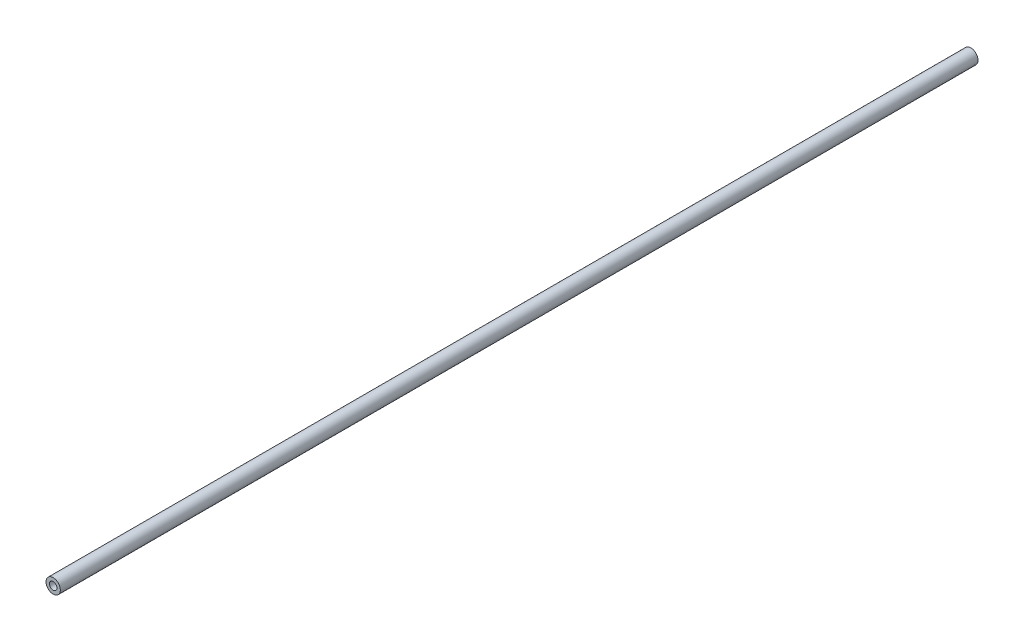
from build123d import *

# Parameters (mm, degrees)
SKETCH1_R           = 4.7625
SKETCH1_R_2         = 2.4892
BOSS_EXTRUDE1_DEPTH = 304.8


with BuildPart() as part:
    # Sketch1 → Boss-Extrude1 (new, symmetric)
    with BuildSketch(Plane.XY):
        Circle(SKETCH1_R)
        Circle(SKETCH1_R_2, mode=Mode.SUBTRACT)
    extrude(amount=BOSS_EXTRUDE1_DEPTH, both=True)


solid = part.part
